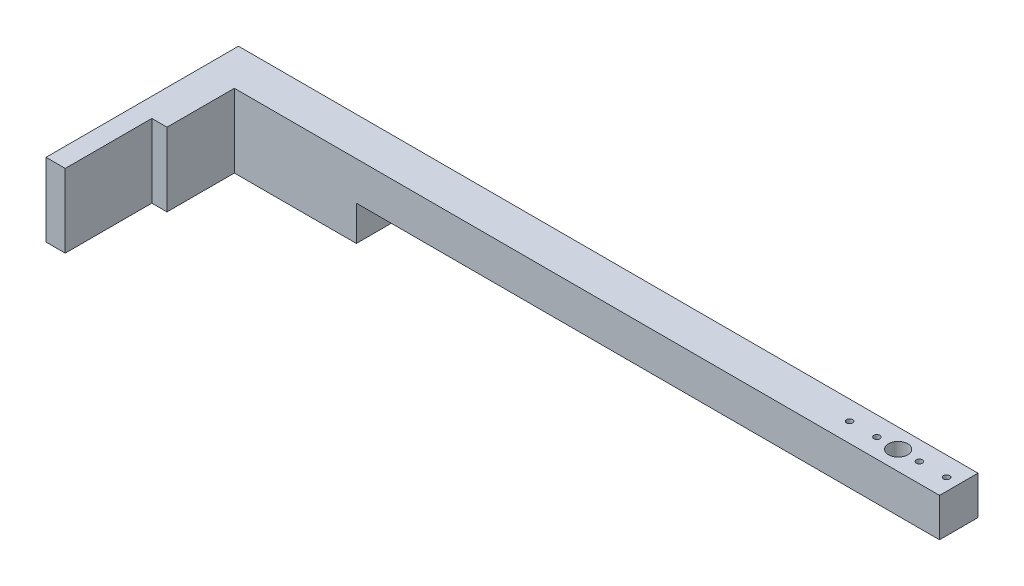
from build123d import *

# Parameters (mm, degrees)
BOSS_EXTRUDE1_DEPTH      = 12.7
BOSS_EXTRUDE1_DEPTH_BACK = 11.525000064
SKETCH5_W                = 12.7
SKETCH5_H                = 12.7
BOSS_EXTRUDE2_DEPTH      = 152.4
SKETCH8_W                = 40.00000001
SKETCH8_H                = 12.7
SKETCH8_R                = 1.000000032
SKETCH8_R_2              = 3.175
BOSS_EXTRUDE3_DEPTH      = 12.7


with BuildPart() as part:
    # Sketch3 → Boss-Extrude1 (new, two sides: drawn at the far end of the back side and taken through both)
    with BuildSketch(Plane(origin=(0, 0, 0), x_dir=(1, 0, 0), z_dir=(0, 1, 0)).offset(-BOSS_EXTRUDE1_DEPTH_BACK)):
        Polygon((0, 0), (-40.25400001, 0), (-40.25400001, -22.225), (-45.254000043, -22.225), (-45.254000043, -50.8), (-51.604000043, -50.8), (-51.604000043, 12.7), (0, 12.7), align=None)
    extrude(amount=BOSS_EXTRUDE1_DEPTH + BOSS_EXTRUDE1_DEPTH_BACK)

    # Sketch5 → Boss-Extrude2 (add)
    with BuildSketch(Plane(origin=(0, 0, 0), x_dir=(0, 0, -1), z_dir=(1, 0, 0))):
        with Locations((6.35, 6.35)):
            Rectangle(SKETCH5_W, SKETCH5_H)
    extrude(amount=BOSS_EXTRUDE2_DEPTH)

    # Sketch8 → Boss-Extrude3 (add)
    with BuildSketch(Plane(origin=(0, 12.7, 0), x_dir=(1, 0, 0), z_dir=(0, 1, 0))):
        with Locations((172.400000005, 6.35)):
            Rectangle(SKETCH8_W, SKETCH8_H)
        with Locations((156.400000001, 6.35)):
            Circle(SKETCH8_R, mode=Mode.SUBTRACT)
        with Locations((165.400000035, 6.35)):
            Circle(SKETCH8_R, mode=Mode.SUBTRACT)
        with Locations((172.400000005, 6.35)):
            Circle(SKETCH8_R_2, mode=Mode.SUBTRACT)
        with Locations((188.400000009, 6.35)):
            Circle(SKETCH8_R, mode=Mode.SUBTRACT)
        with Locations((179.399999975, 6.35)):
            Circle(SKETCH8_R, mode=Mode.SUBTRACT)
    extrude(amount=-BOSS_EXTRUDE3_DEPTH)


solid = part.part
